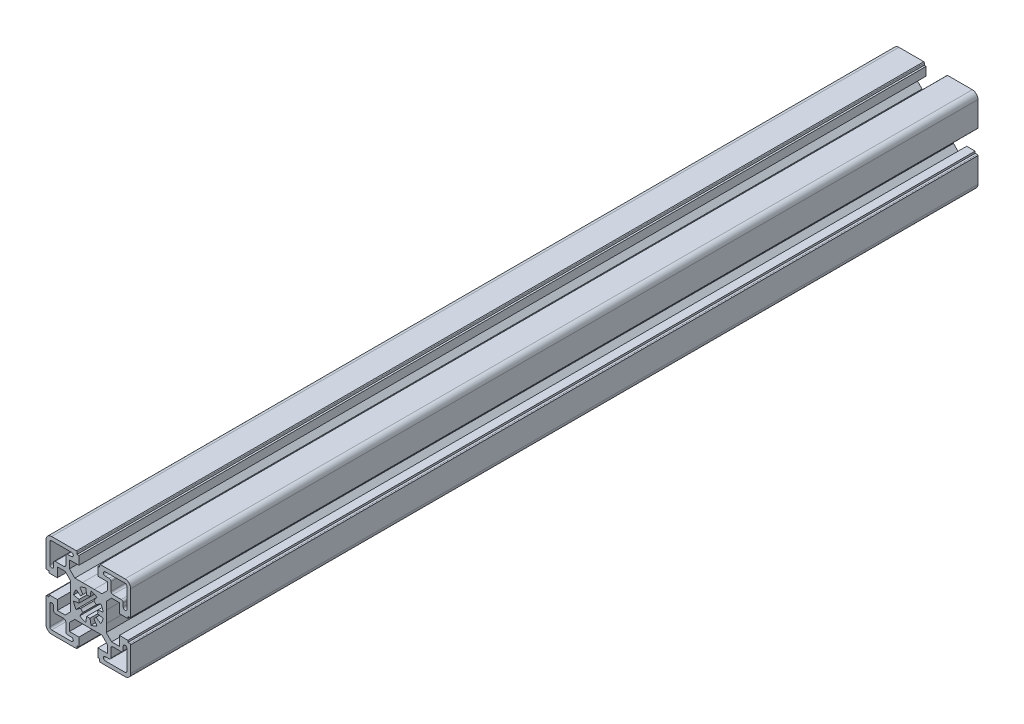
from build123d import *

# Parameters (mm, degrees)
BOSS_EXTRUDE1_DEPTH = 450


with BuildPart() as part:
    # Sketch1 → Boss-Extrude1 (new body)
    with BuildSketch(Plane.XY):
        with BuildLine():
            Line((-9.499953806, 7.206970084), (-9.499953806, 3.122740916))
            Line((-9.499953806, 3.122740916), (-9.499875319, -3.122784036))
            Line((-9.499875319, -3.122784036), (-9.499875319, -7.207137036))
            Line((-9.499875319, -7.207137036), (-12.342824291, -10.050086009))
            Line((-12.342824291, -10.050086009), (-16.499959846, -10.050086009))
            Line((-16.499959846, -10.050086009), (-16.499959846, -5))
            Line((-16.499959846, -5), (-20.999918083, -5))
            Line((-20.999918083, -5), (-20.999918083, -6))
            Line((-20.999918083, -6), (-21.999918456, -6))
            ThreePointArc((-21.999918456, -6), (-22.298205758, -6.069541349), (-22.5, -6.299954884))
            Line((-22.5, -6.299954884), (-22.5, -19.499922911))
            ThreePointArc((-22.5, -19.499922911), (-21.621321, -21.62124167), (-19.500002241, -22.49992067))
            Line((-19.500002241, -22.49992067), (-6.299929564, -22.49992067))
            ThreePointArc((-6.299929564, -22.49992067), (-6.069539801, -22.298164639), (-6, -21.99992119))
            Line((-6, -21.99992119), (-6, -20.999920806))
            Line((-6, -20.999920806), (-4.999940084, -20.999920806))
            Line((-4.999940084, -20.999920806), (-4.999940084, -16.500012806))
            Line((-4.999940084, -16.500012806), (-10.049940084, -16.500012806))
            Line((-10.049940084, -16.500012806), (-10.049940084, -12.342923806))
            Line((-10.049940084, -12.342923806), (-7.206970084, -9.499953806))
            Line((-7.206970084, -9.499953806), (-3.122740916, -9.499953806))
            Line((-3.122740916, -9.499953806), (3.122784036, -9.499875319))
            Line((3.122784036, -9.499875319), (7.207137036, -9.499875319))
            Line((7.207137036, -9.499875319), (10.050086009, -12.342824291))
            Line((10.050086009, -12.342824291), (10.050086009, -16.499959846))
            Line((10.050086009, -16.499959846), (5, -16.499959846))
            Line((5, -16.499959846), (5, -20.999918083))
            Line((5, -20.999918083), (6, -20.999918083))
            Line((6, -20.999918083), (6, -21.999918456))
            ThreePointArc((6, -21.999918456), (6.069541349, -22.298205758), (6.299954884, -22.5))
            Line((6.299954884, -22.5), (19.499922911, -22.5))
            ThreePointArc((19.499922911, -22.5), (21.62124167, -21.621321), (22.49992067, -19.500002241))
            Line((22.49992067, -19.500002241), (22.49992067, -6.299929564))
            ThreePointArc((22.49992067, -6.299929564), (22.298164639, -6.069539801), (21.99992119, -6))
            Line((21.99992119, -6), (20.999920806, -6))
            Line((20.999920806, -6), (20.999920806, -4.999940084))
            Line((20.999920806, -4.999940084), (16.500012806, -4.999940084))
            Line((16.500012806, -4.999940084), (16.500012806, -10.049940084))
            Line((16.500012806, -10.049940084), (12.342923806, -10.049940084))
            Line((12.342923806, -10.049940084), (9.499953806, -7.206970084))
            Line((9.499953806, -7.206970084), (9.499953806, -3.122740916))
            Line((9.499953806, -3.122740916), (9.499875319, 3.122784036))
            Line((9.499875319, 3.122784036), (9.499875319, 7.207137036))
            Line((9.499875319, 7.207137036), (12.342824291, 10.050086009))
            Line((12.342824291, 10.050086009), (16.499959846, 10.050086009))
            Line((16.499959846, 10.050086009), (16.499959846, 5))
            Line((16.499959846, 5), (20.999918083, 5))
            Line((20.999918083, 5), (20.999918083, 6))
            Line((20.999918083, 6), (21.999918456, 6))
            ThreePointArc((21.999918456, 6), (22.298205758, 6.069541349), (22.5, 6.299954884))
            Line((22.5, 6.299954884), (22.5, 19.499922911))
            ThreePointArc((22.5, 19.499922911), (21.621321, 21.62124167), (19.500002241, 22.49992067))
            Line((19.500002241, 22.49992067), (6.299929564, 22.49992067))
            ThreePointArc((6.299929564, 22.49992067), (6.069539801, 22.298164639), (6, 21.99992119))
            Line((6, 21.99992119), (6, 20.999920806))
            Line((6, 20.999920806), (4.999940084, 20.999920806))
            Line((4.999940084, 20.999920806), (4.999940084, 16.500012806))
            Line((4.999940084, 16.500012806), (10.049940084, 16.500012806))
            Line((10.049940084, 16.500012806), (10.049940084, 12.342923806))
            Line((10.049940084, 12.342923806), (7.206970084, 9.499953806))
            Line((7.206970084, 9.499953806), (3.122740916, 9.499953806))
            Line((3.122740916, 9.499953806), (-3.122784036, 9.499875319))
            Line((-3.122784036, 9.499875319), (-7.207137036, 9.499875319))
            Line((-7.207137036, 9.499875319), (-10.050086009, 12.342824291))
            Line((-10.050086009, 12.342824291), (-10.050086009, 16.499959846))
            Line((-10.050086009, 16.499959846), (-5, 16.499959846))
            Line((-5, 16.499959846), (-5, 20.999918083))
            Line((-5, 20.999918083), (-6, 20.999918083))
            Line((-6, 20.999918083), (-6, 21.999918456))
            ThreePointArc((-6, 21.999918456), (-6.069541349, 22.298205758), (-6.299954884, 22.5))
            Line((-6.299954884, 22.5), (-19.499922911, 22.5))
            ThreePointArc((-19.499922911, 22.5), (-21.62124167, 21.621321), (-22.49992067, 19.500002241))
            Line((-22.49992067, 19.500002241), (-22.49992067, 6.299929564))
            ThreePointArc((-22.49992067, 6.299929564), (-22.298164639, 6.069539801), (-21.99992119, 6))
            Line((-21.99992119, 6), (-20.999920806, 6))
            Line((-20.999920806, 6), (-20.999920806, 4.999940084))
            Line((-20.999920806, 4.999940084), (-16.500012806, 4.999940084))
            Line((-16.500012806, 4.999940084), (-16.500012806, 10.049940084))
            Line((-16.500012806, 10.049940084), (-12.342923806, 10.049940084))
            Line((-12.342923806, 10.049940084), (-9.499953806, 7.206970084))
        make_face()
        with BuildLine():
            Line((-12.000017917, -13.000117238), (-12.000017917, -17.500118733))
            ThreePointArc((-12.000017917, -17.500118733), (-11.707124917, -18.207224985), (-11.000018664, -18.500117985))
            Line((-11.000018664, -18.500117985), (-8.999920083, -18.500117985))
            ThreePointArc((-8.999920083, -18.500117985), (-7.999920083, -19.500117985), (-8.999920083, -20.500117985))
            Line((-8.999920083, -20.500117985), (-19.500018664, -20.500117985))
            ThreePointArc((-19.500018664, -20.500117985), (-20.207124917, -20.207224985), (-20.500017917, -19.500118733))
            Line((-20.500017917, -19.500118733), (-20.500017917, -9.000117986))
            ThreePointArc((-20.500017917, -9.000117986), (-19.499969, -8.000069069), (-18.499920083, -9.000117986))
            Line((-18.499920083, -9.000117986), (-18.499920083, -11.000118733))
            ThreePointArc((-18.499920083, -11.000118733), (-18.207027083, -11.707224986), (-17.49992083, -12.000117986))
            Line((-17.49992083, -12.000117986), (-13.00001717, -12.000117986))
            ThreePointArc((-13.00001717, -12.000117986), (-12.292910917, -12.293010986), (-12.000017917, -13.000117238))
        make_face(mode=Mode.SUBTRACT)
        with BuildLine():
            Line((13.000117238, -12.000017917), (17.500118733, -12.000017917))
            ThreePointArc((17.500118733, -12.000017917), (18.207224985, -11.707124917), (18.500117985, -11.000018664))
            Line((18.500117985, -11.000018664), (18.500117985, -8.999920083))
            ThreePointArc((18.500117985, -8.999920083), (19.500117985, -7.999920083), (20.500117985, -8.999920083))
            Line((20.500117985, -8.999920083), (20.500117985, -19.500018664))
            ThreePointArc((20.500117985, -19.500018664), (20.207224985, -20.207124917), (19.500118733, -20.500017917))
            Line((19.500118733, -20.500017917), (9.000117986, -20.500017917))
            ThreePointArc((9.000117986, -20.500017917), (8.000069069, -19.499969), (9.000117986, -18.499920083))
            Line((9.000117986, -18.499920083), (11.000118733, -18.499920083))
            ThreePointArc((11.000118733, -18.499920083), (11.707224986, -18.207027083), (12.000117986, -17.49992083))
            Line((12.000117986, -17.49992083), (12.000117986, -13.00001717))
            ThreePointArc((12.000117986, -13.00001717), (12.293010986, -12.292910917), (13.000117238, -12.000017917))
        make_face(mode=Mode.SUBTRACT)
        with BuildLine():
            Line((-13.000117238, 12.000017917), (-17.500118733, 12.000017917))
            ThreePointArc((-17.500118733, 12.000017917), (-18.207224985, 11.707124917), (-18.500117985, 11.000018664))
            Line((-18.500117985, 11.000018664), (-18.500117985, 8.999920083))
            ThreePointArc((-18.500117985, 8.999920083), (-19.500117986, 7.999920083), (-20.500117986, 8.999920083))
            Line((-20.500117986, 8.999920083), (-20.500117986, 19.500018664))
            ThreePointArc((-20.500117986, 19.500018664), (-20.207224985, 20.207124917), (-19.500118733, 20.500017917))
            Line((-19.500118733, 20.500017917), (-9.000117986, 20.500017917))
            ThreePointArc((-9.000117986, 20.500017917), (-8.000069069, 19.499969), (-9.000117986, 18.499920083))
            Line((-9.000117986, 18.499920083), (-11.000118733, 18.499920083))
            ThreePointArc((-11.000118733, 18.499920083), (-11.707224986, 18.207027083), (-12.000117986, 17.49992083))
            Line((-12.000117986, 17.49992083), (-12.000117986, 13.00001717))
            ThreePointArc((-12.000117986, 13.00001717), (-12.293010986, 12.292910917), (-13.000117238, 12.000017917))
        make_face(mode=Mode.SUBTRACT)
        with BuildLine():
            Line((-1.389161146, 7.878452813), (-0.868223842, 4.924022376))
            ThreePointArc((-0.868223842, 4.924022376), (6.442e-06, 4.9999809), (0.868236529, 4.924020139))
            Line((0.868236529, 4.924020139), (1.389181447, 7.878449234))
            ThreePointArc((1.389181447, 7.878449234), (3.061463561, 7.391023494), (4.588607361, 6.553203027))
            Line((4.588607361, 6.553203027), (2.867873408, 4.095743048))
            ThreePointArc((2.867873408, 4.095743048), (3.535515019, 3.535525782), (4.095734317, 2.867885877))
            Line((4.095734317, 2.867885877), (6.553189057, 4.588627311))
            ThreePointArc((6.553189057, 4.588627311), (7.391022778, 3.061465289), (7.878452813, 1.389161146))
            Line((7.878452813, 1.389161146), (4.924022376, 0.868223842))
            ThreePointArc((4.924022376, 0.868223842), (4.9999809, -6.442e-06), (4.924020139, -0.868236529))
            Line((4.924020139, -0.868236529), (7.878449234, -1.389181447))
            ThreePointArc((7.878449234, -1.389181447), (7.391023494, -3.061463561), (6.553203027, -4.588607361))
            Line((6.553203027, -4.588607361), (4.095743048, -2.867873408))
            ThreePointArc((4.095743048, -2.867873408), (3.535525782, -3.535515019), (2.867885877, -4.095734317))
            Line((2.867885877, -4.095734317), (4.588627311, -6.553189057))
            ThreePointArc((4.588627311, -6.553189057), (3.061465289, -7.391022778), (1.389161146, -7.878452813))
            Line((1.389161146, -7.878452813), (0.868223842, -4.924022376))
            ThreePointArc((0.868223842, -4.924022376), (-6.442e-06, -4.9999809), (-0.868236529, -4.924020139))
            Line((-0.868236529, -4.924020139), (-1.389181447, -7.878449234))
            ThreePointArc((-1.389181447, -7.878449234), (-3.061463561, -7.391023494), (-4.588607361, -6.553203027))
            Line((-4.588607361, -6.553203027), (-2.867873408, -4.095743048))
            ThreePointArc((-2.867873408, -4.095743048), (-3.535515019, -3.535525782), (-4.095734317, -2.867885877))
            Line((-4.095734317, -2.867885877), (-6.553189057, -4.588627311))
            ThreePointArc((-6.553189057, -4.588627311), (-7.391022778, -3.061465289), (-7.878452813, -1.389161146))
            Line((-7.878452813, -1.389161146), (-4.924022376, -0.868223842))
            ThreePointArc((-4.924022376, -0.868223842), (-4.9999809, 6.442e-06), (-4.924020139, 0.868236529))
            Line((-4.924020139, 0.868236529), (-7.878449234, 1.389181447))
            ThreePointArc((-7.878449234, 1.389181447), (-7.391023494, 3.061463561), (-6.553203027, 4.588607361))
            Line((-6.553203027, 4.588607361), (-4.095743048, 2.867873408))
            ThreePointArc((-4.095743048, 2.867873408), (-3.535525782, 3.535515019), (-2.867885877, 4.095734317))
            Line((-2.867885877, 4.095734317), (-4.588627311, 6.553189057))
            ThreePointArc((-4.588627311, 6.553189057), (-3.061465289, 7.391022778), (-1.389161146, 7.878452813))
        make_face(mode=Mode.SUBTRACT)
        with BuildLine():
            Line((12.000017917, 13.000117238), (12.000017917, 17.500118733))
            ThreePointArc((12.000017917, 17.500118733), (11.707124917, 18.207224985), (11.000018664, 18.500117985))
            Line((11.000018664, 18.500117985), (8.999920083, 18.500117985))
            ThreePointArc((8.999920083, 18.500117985), (7.999920083, 19.500117985), (8.999920083, 20.500117985))
            Line((8.999920083, 20.500117985), (19.500018664, 20.500117985))
            ThreePointArc((19.500018664, 20.500117985), (20.207124917, 20.207224985), (20.500017917, 19.500118733))
            Line((20.500017917, 19.500118733), (20.500017917, 9.000117986))
            ThreePointArc((20.500017917, 9.000117986), (19.499969, 8.000069069), (18.499920083, 9.000117986))
            Line((18.499920083, 9.000117986), (18.499920083, 11.000118733))
            ThreePointArc((18.499920083, 11.000118733), (18.207027083, 11.707224986), (17.49992083, 12.000117986))
            Line((17.49992083, 12.000117986), (13.00001717, 12.000117986))
            ThreePointArc((13.00001717, 12.000117986), (12.292910917, 12.293010986), (12.000017917, 13.000117238))
        make_face(mode=Mode.SUBTRACT)
    extrude(amount=BOSS_EXTRUDE1_DEPTH)


solid = part.part
